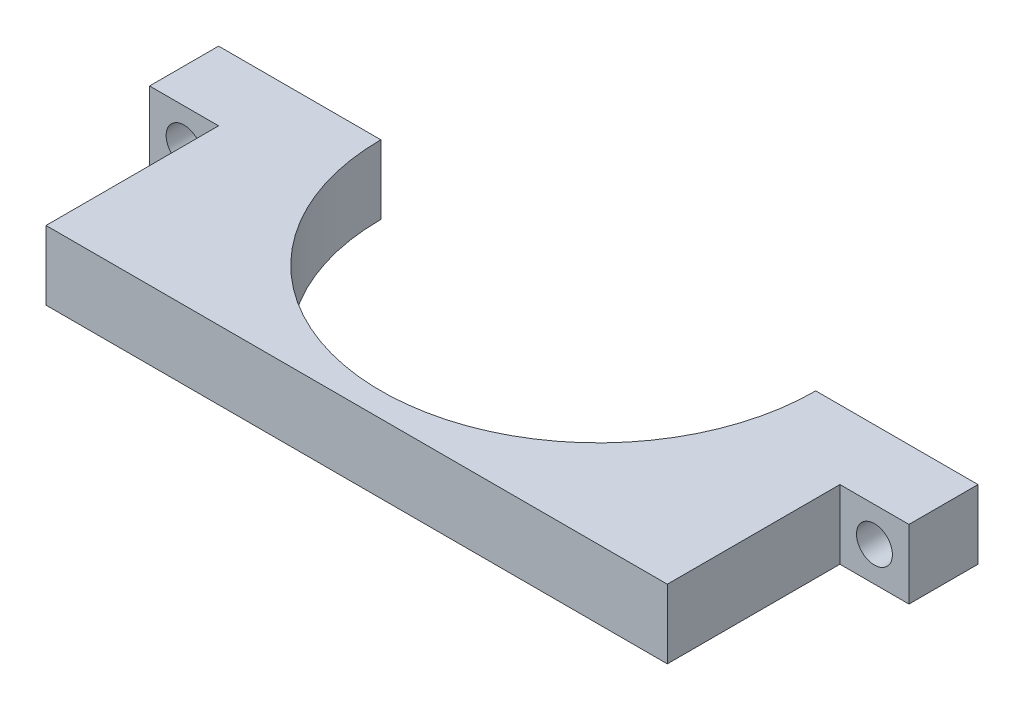
from build123d import *

# Parameters (mm, degrees)
BOSS_EXTRUDE1_DEPTH = 12.7
CUT_EXTRUDE1_REACH  = 87.379
SKETCH2_R           = 3.302


with BuildPart() as part:
    # Sketch1 → Boss-Extrude1 (new body)
    with BuildSketch(Plane(origin=(0, 0, 0), x_dir=(1, 0, 0), z_dir=(0, 1, 0))):
        with BuildLine():
            Line((-31.62284398, 0), (-61.46784398, 0))
            Line((-61.46784398, 0), (-61.46784398, -12.7))
            Line((-61.46784398, -12.7), (-48.76784398, -12.7))
            Line((-48.76784398, -12.7), (-48.76784398, -44.45))
            Line((-48.76784398, -44.45), (65.53215602, -44.45))
            Line((65.53215602, -44.45), (65.53215602, -12.7))
            Line((65.53215602, -12.7), (78.23215602, -12.7))
            Line((78.23215602, -12.7), (78.23215602, 0))
            Line((78.23215602, 0), (48.38715602, 0))
            ThreePointArc((48.38715602, 0), (8.38215602, -40.005), (-31.62284398, 0))
        make_face()
    extrude(amount=BOSS_EXTRUDE1_DEPTH)

    # Sketch2 → Cut-Extrude1 (cut, up to next)
    with BuildSketch(Plane.XY.offset(12.7), mode=Mode.PRIVATE) as cut_extrude1_sk1:
        with Locations((71.88215602, 6.35)):
            Circle(SKETCH2_R)
    cut_extrude1_tool1 = extrude(cut_extrude1_sk1.sketch, amount=-CUT_EXTRUDE1_REACH, mode=Mode.PRIVATE) & part.part
    # Sketch2 → Cut-Extrude1 (cut, up to next)
    with BuildSketch(Plane.XY.offset(12.7), mode=Mode.PRIVATE) as cut_extrude1_sk2:
        with Locations((-55.11784398, 6.35)):
            Circle(SKETCH2_R)
    cut_extrude1_tool2 = extrude(cut_extrude1_sk2.sketch, amount=-CUT_EXTRUDE1_REACH, mode=Mode.PRIVATE) & part.part
    add(cut_extrude1_tool1.solids().sort_by_distance((71.882156, 6.35, 12.7))[0], mode=Mode.SUBTRACT)
    add(cut_extrude1_tool2.solids().sort_by_distance((-55.117844, 6.35, 12.7))[0], mode=Mode.SUBTRACT)


solid = part.part
